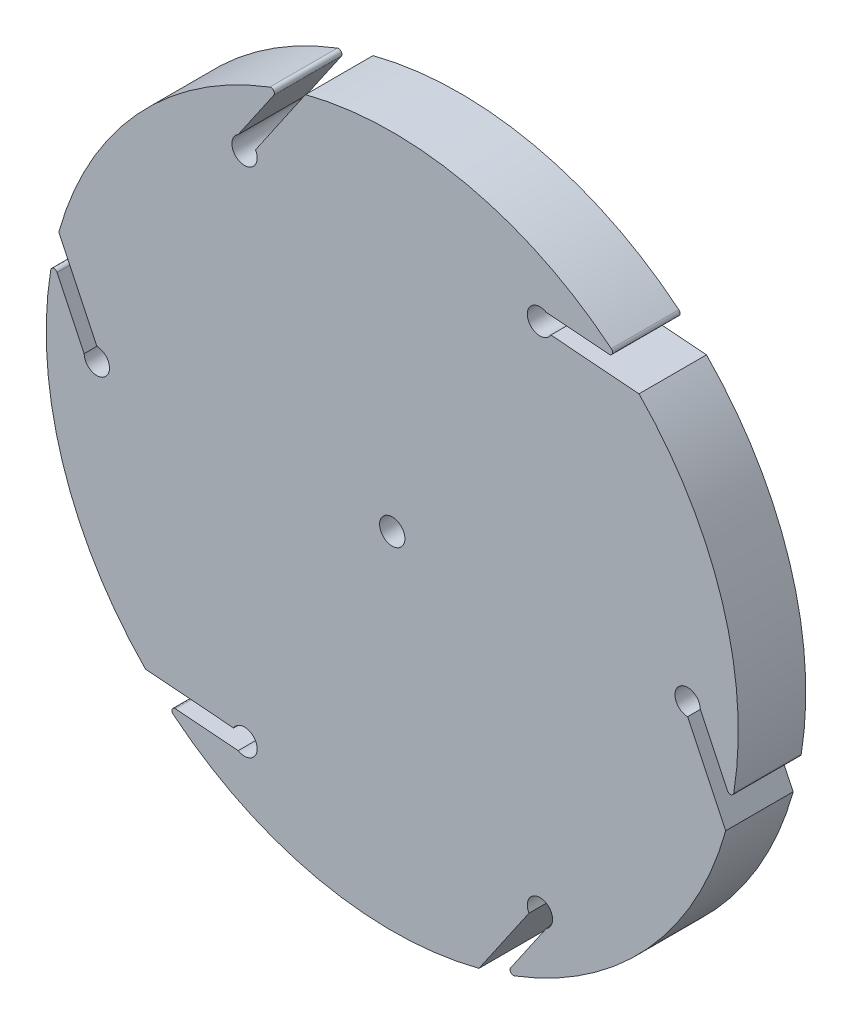
from build123d import *

# Parameters (mm, degrees)
MODEL_R                        = 20.5
MODEL_R_2                      = 0.75
MAIN_DIFFERENTIAL_DISK_DEPTH   = 4
TENDON_HOLDER_DEPTH            = 30.266021253
DIFFERENTIAL_DISK_CONTOURING_R = 0.2


with BuildPart() as part:
    # Model → Main Differential Disk (new body)
    with BuildSketch(Plane.XY):
        Circle(MODEL_R)
        with Locations((-8.75, 15.155444566)):
            Circle(MODEL_R_2, mode=Mode.SUBTRACT)
        with Locations((8.75, 15.155444566)):
            Circle(MODEL_R_2, mode=Mode.SUBTRACT)
        with Locations((17.5, 0)):
            Circle(MODEL_R_2, mode=Mode.SUBTRACT)
        with Locations((8.75, -15.155444566)):
            Circle(MODEL_R_2, mode=Mode.SUBTRACT)
        with Locations((-8.75, -15.155444566)):
            Circle(MODEL_R_2, mode=Mode.SUBTRACT)
        Circle(MODEL_R_2, mode=Mode.SUBTRACT)
        with Locations((-17.5, 0)):
            Circle(MODEL_R_2, mode=Mode.SUBTRACT)
    extrude(amount=MAIN_DIFFERENTIAL_DISK_DEPTH)

    # Sketch1 → Tendon Holder (cut, through all)
    with BuildSketch(Plane.XY.offset(4)):
        with BuildLine():
            Line((-18.25, 0), (-20.121847663, 3.919342625))
            ThreePointArc((-20.121847663, 3.919342625), (-19.953970316, 4.699900916), (-19.755825892, 5.473330187))
            Line((-19.755825892, 5.473330187), (-17.5, 0.75))
            ThreePointArc((-17.5, 0.75), (-16.969669914, -0.530330086), (-18.25, 0))
        make_face()
        with BuildLine():
            Line((-9.125, 15.804963619), (-6.666673552, 19.38570256))
            ThreePointArc((-6.666673552, 19.38570256), (-5.906751569, 19.630595658), (-5.137869961, 19.845712188))
            Line((-5.137869961, 19.845712188), (-8.100480947, 15.530444566))
            ThreePointArc((-8.100480947, 15.530444566), (-8.944114284, 14.431000197), (-9.125, 15.804963619))
        make_face()
        with BuildLine():
            Line((9.125, 15.804963619), (13.455174111, 15.466359935))
            ThreePointArc((13.455174111, 15.466359935), (14.047218747, 14.930694742), (14.617955931, 14.372382002))
            Line((14.617955931, 14.372382002), (9.399519053, 14.780444566))
            ThreePointArc((9.399519053, 14.780444566), (8.02555563, 14.961330282), (9.125, 15.804963619))
        make_face()
        with BuildLine():
            Line((18.25, 0), (20.121847663, -3.919342625))
            ThreePointArc((20.121847663, -3.919342625), (19.953970316, -4.699900916), (19.755825892, -5.473330187))
            Line((19.755825892, -5.473330187), (17.5, -0.75))
            ThreePointArc((17.5, -0.75), (16.969669914, 0.530330086), (18.25, 0))
        make_face()
        with BuildLine():
            Line((9.125, -15.804963619), (6.666673552, -19.38570256))
            ThreePointArc((6.666673552, -19.38570256), (5.906751569, -19.630595658), (5.137869961, -19.845712188))
            Line((5.137869961, -19.845712188), (8.100480947, -15.530444566))
            ThreePointArc((8.100480947, -15.530444566), (8.944114284, -14.431000197), (9.125, -15.804963619))
        make_face()
        with BuildLine():
            Line((-9.125, -15.804963619), (-13.455174111, -15.466359935))
            ThreePointArc((-13.455174111, -15.466359935), (-14.047218747, -14.930694742), (-14.617955931, -14.372382002))
            Line((-14.617955931, -14.372382002), (-9.399519053, -14.780444566))
            ThreePointArc((-9.399519053, -14.780444566), (-8.02555563, -14.961330282), (-9.125, -15.804963619))
        make_face()
    extrude(amount=-TENDON_HOLDER_DEPTH, mode=Mode.SUBTRACT)

    # Differential Disk Contouring
    differential_disk_contouring_edges = [part.edges().sort_by_distance(p)[0] for p in [
        (-20.121847663, 3.919342625, 2),
        (-13.455174111, -15.466359935, 2),
        (6.666673552, -19.38570256, 2),
        (20.121847663, -3.919342625, 2),
        (13.455174111, 15.466359935, 2),
        (-6.666673552, 19.38570256, 2),
    ]]
    fillet(differential_disk_contouring_edges, radius=DIFFERENTIAL_DISK_CONTOURING_R)


solid = part.part
